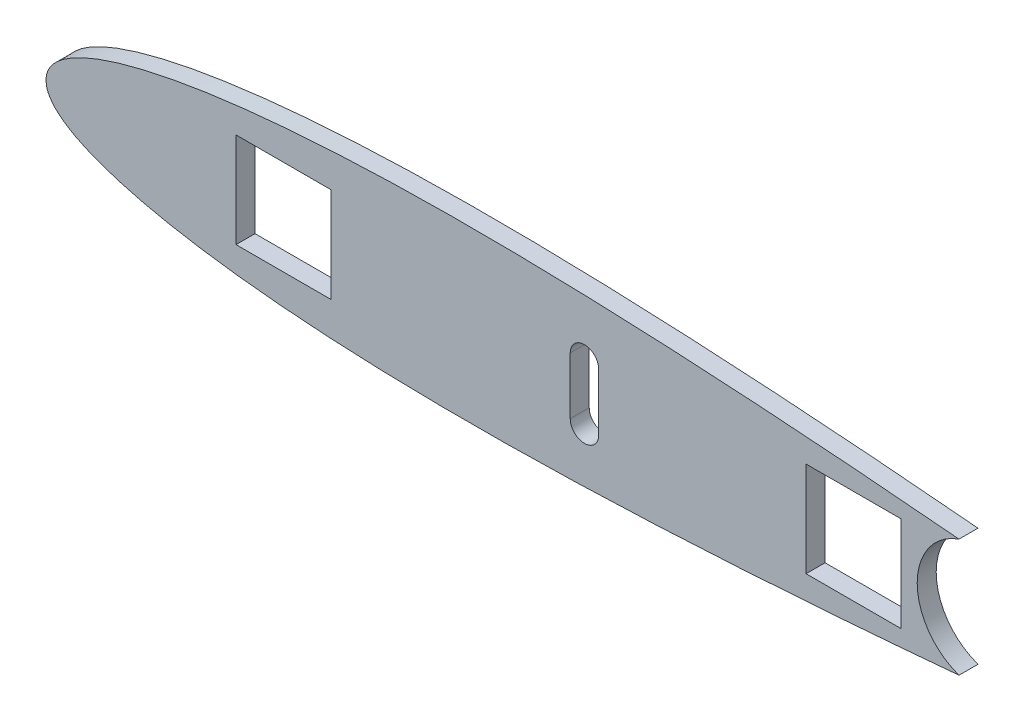
from build123d import *

# Parameters (mm, degrees)
BOSS_EXTRUDE1_DEPTH = 2
SKETCH2_W           = 10
SKETCH2_H           = 10
CUT_EXTRUDE1_DEPTH  = 2
CUT_EXTRUDE2_DEPTH  = 2
SPLIT2_DEPTH        = 2


# Read off the part's stored shape, not the designer's step: Split2
with BuildPart() as part:
    # Sketch1 → Boss-Extrude1 (new body)
    with BuildSketch(Plane.XY):
        with BuildLine():
            add(Edge.make_bspline(
                [(0, 0), (0.017737679, 0.21563179), (0.054124727, 0.657978531), (0.343214492, 1.298862569), (0.793518335, 1.915453085), (1.418593739, 2.510411621), (2.210440726, 3.08584076), (3.169840337, 3.64229027), (4.294762462, 4.179129104), (5.583413569, 4.69513941), (7.033172592, 5.188783743), (8.640964446, 5.658406049), (11.080866503, 6.272892351), (14.502446863, 6.955454069), (19.033265173, 7.627780104), (24.084738243, 8.169485105), (29.61030038, 8.573350569), (36.653446176, 8.884204814), (45.268552866, 8.994485881), (55.449246929, 8.823980559), (67.247179838, 8.346573268), (80.384127491, 7.524875895), (94.475089666, 6.381384792), (108.784193237, 5.015612692), (123.127907022, 3.461297117), (136.57914049, 1.828195781), (145.420848795, 0.64480177), (149.505193273, 0.070051229), (149.970810304, 0.00413247), (150, 0)],
                knots=[0, 0, 0, 0, 0.004217542, 0.008651859, 0.013562306, 0.019137014, 0.025499556, 0.032726168, 0.040861643, 0.049929832, 0.059940125, 0.070891981, 0.082777029, 0.109285667, 0.139301078, 0.172602407, 0.208924358, 0.247964735, 0.310881146, 0.377906083, 0.447678538, 0.542484027, 0.636086648, 0.724985379, 0.824439816, 0.919092539, 0.990775422, 0.999421708, 1, 1, 1, 1], degree=3))
            add(Edge.make_bspline(
                [(0, 0), (0.017737679, -0.21563179), (0.054124727, -0.657978531), (0.343214492, -1.298862569), (0.793518335, -1.915453085), (1.418593739, -2.510411621), (2.210440726, -3.08584076), (3.169840337, -3.64229027), (4.294762462, -4.179129104), (5.583413569, -4.69513941), (7.033172592, -5.188783743), (8.640964446, -5.658406049), (11.080866503, -6.272892351), (14.502446863, -6.955454069), (19.033265173, -7.627780104), (24.084738243, -8.169485105), (29.61030038, -8.573350569), (36.653446176, -8.884204814), (45.268552866, -8.994485881), (55.449246929, -8.823980559), (67.247179838, -8.346573268), (80.384127491, -7.524875895), (94.475089666, -6.381384792), (108.784193237, -5.015612692), (123.127907022, -3.461297117), (136.57914049, -1.828195781), (145.420848795, -0.64480177), (149.505193273, -0.070051229), (149.970810304, -0.00413247), (150, 0)],
                knots=[0, 0, 0, 0, 0.004217542, 0.008651859, 0.013562306, 0.019137014, 0.025499556, 0.032726168, 0.040861643, 0.049929832, 0.059940125, 0.070891981, 0.082777029, 0.109285667, 0.139301078, 0.172602407, 0.208924358, 0.247964735, 0.310881146, 0.377906083, 0.447678538, 0.542484027, 0.636086648, 0.724985379, 0.824439816, 0.919092539, 0.990775422, 0.999421708, 1, 1, 1, 1], degree=3))
        make_face()
    extrude(amount=BOSS_EXTRUDE1_DEPTH)

    # Sketch2 → Cut-Extrude1 (cut)
    with BuildSketch(Plane.XY.offset(2)):
        with Locations((25, 0)):
            Rectangle(SKETCH2_W, SKETCH2_H)
        with Locations((85, 0)):
            Rectangle(SKETCH2_W, SKETCH2_H)
    extrude(amount=-CUT_EXTRUDE1_DEPTH, mode=Mode.SUBTRACT)

    # Sketch3 → Cut-Extrude2 (cut)
    with BuildSketch(Plane.XY.offset(2)):
        with BuildLine():
            Line((55.177854161, -3.279241302), (55.177854161, 2.721162631))
            ThreePointArc((55.177854161, 2.721162631), (56.677955144, 4.221263615), (58.178056128, 2.721162631))
            Line((58.178056128, 2.721162631), (58.178056128, -3.279241302))
            ThreePointArc((58.178056128, -3.279241302), (56.677955144, -4.779342285), (55.177854161, -3.279241302))
        make_face()
    extrude(amount=-CUT_EXTRUDE2_DEPTH, mode=Mode.SUBTRACT)

    # Split2 outline → Split2 (cut)
    with BuildSketch(Plane.XY):
        with BuildLine():
            add(Edge.make_bspline(
                [(150, 0), (149.970810304, 0.00413247), (149.505193273, 0.070051229), (145.420848795, 0.64480177), (136.57914049, 1.828195781), (123.127907022, 3.461297117), (109.245806797, 4.965591257), (100.149772472, 5.839460679), (96.098442191, 6.203662705)],
                knots=[0, 0, 0, 0, 0.000578292, 0.009224578, 0.080907461, 0.175560184, 0.275014621, 0.354805575, 0.354805575, 0.354805575, 0.354805575], degree=3))
            ThreePointArc((96.098442191, 6.203662705), (91.699107152, 0), (96.098442191, -6.203662705))
            add(Edge.make_bspline(
                [(96.098442191, -6.203662705), (100.149772472, -5.839460679), (109.245806797, -4.965591257), (123.127907022, -3.461297117), (136.57914049, -1.828195781), (145.420848795, -0.64480177), (149.505193273, -0.070051229), (149.970810304, -0.00413247), (150, 0)],
                knots=[0.645194425, 0.645194425, 0.645194425, 0.645194425, 0.724985379, 0.824439816, 0.919092539, 0.990775422, 0.999421708, 1, 1, 1, 1], degree=3))
        make_face()
    extrude(amount=SPLIT2_DEPTH, mode=Mode.SUBTRACT)


solid = part.part
